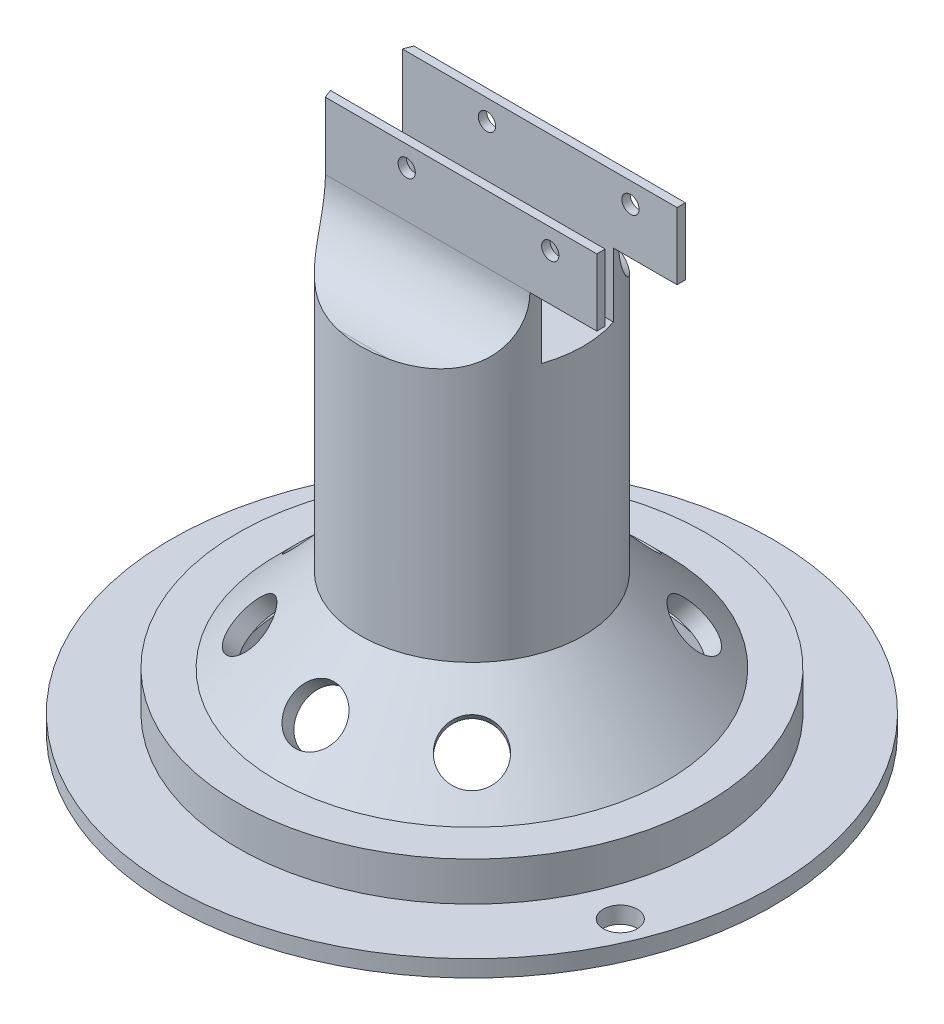
from build123d import *
from build123d.topology import SkipClean

# Parameters (mm, degrees)
R_P_TITION_CIRCULAIRE1_COUNT               = 4
R_P_TITION_CIRCULAIRE1_ANGLE               = 135
R_P_TITION_CIRCULAIRE1_THE_OTHER_WAY_COUNT = 4
R_P_TITION_CIRCULAIRE1_THE_OTHER_WAY_ANGLE = 135
ESQUISSE4_R                                = 20
BOSS_EXTRU_1_DEPTH                         = 45
ENL_V_MAT_EXTRU_1_REACH                    = 88.585
ESQUISSE5_R                                = 5.9
ESQUISSE6_R                                = 16.757359313
ENL_V_MAT_EXTRU_2_DEPTH                    = 45
BOSS_EXTRU_3_DEPTH                         = 23.5
ESQUISSE17_R                               = 1.55
ENL_V_MAT_EXTRU_3_DEPTH                    = 97.805229714
BOSS_EXTRU_4_REACH                         = 98.805
ESQUISSE18_W                               = 12
ESQUISSE18_H                               = 12
ESQUISSE20_W                               = 12
ESQUISSE20_H                               = 12.9
ENL_V_MAT_EXTRU_4_DEPTH                    = 23.5
ENL_V_MAT_EXTRU_5_DEPTH                    = 97.805229714
ENL_V_MAT_EXTRU_5_DEPTH_BACK               = 97.805229714
ESQUISSE21_R                               = 1.55
CONG_1_R                                   = 11.5
REMPLACE_START                             = 4
ESQUISSE22_R                               = 42
ESQUISSE22_R_2                             = 33.757359313
REMPLACE_ENTRETOISE_DEPTH                  = 4
ESQUISSE23_R                               = 54
ESQUISSE23_R_2                             = 33
COMPATIBLE_PURGEUR_DEPTH                   = 3
CONG_2_R                                   = 1
BOSS_EXTRU_7_START                         = -3
ESQUISSE25_R                               = 29.5
ESQUISSE25_R_2                             = 27.5
BOSS_EXTRU_7_DEPTH                         = 3
ENL_V_MAT_EXTRU_7_REACH                    = 122.724
ESQUISSE26_R                               = 3.05


with BuildPart() as part:
    # Esquisse1 → Révolution2 (revolve)
    with BuildSketch(Plane.XY, mode=Mode.PRIVATE) as r_volution2_sk:
        Polygon((-42, -12), (-42, -15), (-33.757359313, -15), (-18.757359313, 0), (0, 0), (0, 3), (-20, 3), (-35, -12), align=None)
    revolve(r_volution2_sk.sketch.rotate(Axis((0, 0, 0), (0, 1, 0)), 270), axis=Axis((0, 0, 0), (0, 1, 0)))

    # Esquisse3 → Enlèvement de matière-Révolution1 (revolve, cut)
    with BuildSketch(Plane.XY, mode=Mode.PRIVATE) as enl_vement_de_mati_re_r_volution1_sk:
        Polygon((-28.915567928, -4.501354365), (-25.4507447, -1.036531137), (-11.487275837, -15), (-14.952099065, -18.464823228), align=None)
    enl_vement_de_mati_re_r_volution1 = revolve(enl_vement_de_mati_re_r_volution1_sk.sketch.rotate(Axis((-28.915567928, -4.501354365, 0), (0.7071067811865492, -0.7071067811865459, 0)), 213.499567999), axis=Axis((-28.915567928, -4.501354365, 0), (0.7071067811865492, -0.7071067811865459, 0)), mode=Mode.SUBTRACT)

    # Répétition circulaire1: Enlèvement de matière-Révolution1 ×4 about axis
    r_p_tition_circulaire1_axis = Axis((0, 3, 0), (0, -1, 0))
    for i in range(1, R_P_TITION_CIRCULAIRE1_COUNT):
        add(enl_vement_de_mati_re_r_volution1.rotate(r_p_tition_circulaire1_axis, i * R_P_TITION_CIRCULAIRE1_ANGLE / (R_P_TITION_CIRCULAIRE1_COUNT - 1)), mode=Mode.SUBTRACT)

    # Répétition circulaire1 the other way: Enlèvement de matière-Révolution1 ×4 about axis
    r_p_tition_circulaire1_the_other_way_axis = Axis((0, 3, 0), (0, 1, 0))
    for i in range(1, R_P_TITION_CIRCULAIRE1_THE_OTHER_WAY_COUNT):
        add(enl_vement_de_mati_re_r_volution1.rotate(r_p_tition_circulaire1_the_other_way_axis, i * R_P_TITION_CIRCULAIRE1_THE_OTHER_WAY_ANGLE / (R_P_TITION_CIRCULAIRE1_THE_OTHER_WAY_COUNT - 1)), mode=Mode.SUBTRACT)

    # Esquisse4 → Boss.-Extru.1 (add)
    with BuildSketch(Plane(origin=(0, 3, 0), x_dir=(1, 0, 0), z_dir=(0, 1, 0))):
        with Locations(Location((0, 0, 0), (0, 0, 90))):
            Circle(ESQUISSE4_R)
    extrude(amount=BOSS_EXTRU_1_DEPTH)

    # Esquisse5 → Enlèv. mat.-Extru.1 (cut, up to next)
    with BuildSketch(Plane(origin=(0, 48, 0), x_dir=(1, 0, 0), z_dir=(0, 1, 0)), mode=Mode.PRIVATE) as enl_v_mat_extru_1_sk1:
        with Locations(Location((0, 0, 0), (0, 0, 270))):
            Circle(ESQUISSE5_R)
    enl_v_mat_extru_1_tool1 = extrude(enl_v_mat_extru_1_sk1.sketch, amount=-ENL_V_MAT_EXTRU_1_REACH, mode=Mode.PRIVATE) & part.part
    add(enl_v_mat_extru_1_tool1.solids().sort_by_distance((0, 48, 0))[0], mode=Mode.SUBTRACT)

    # Esquisse6 → Enlèv. mat.-Extru.2 (cut)
    with BuildSketch(Plane(origin=(0, 0, 0), x_dir=(-1, 0, 0), z_dir=(0, -1, 0))):
        with Locations(Location((0, 0, 0), (0, 0, 90))):
            Circle(ESQUISSE6_R)
    extrude(amount=-ENL_V_MAT_EXTRU_2_DEPTH, mode=Mode.SUBTRACT)

    # Esquisse16 → Boss.-Extru.3 (add)
    with BuildSketch(Plane(origin=(0, 48, 0), x_dir=(1, 0, 0), z_dir=(0, 1, 0))):
        with BuildLine():
            Line((18.352043483, 7.95), (-18.352043483, 7.95))
            ThreePointArc((-18.352043483, 7.95), (-18.65679741, 7.205824754), (-18.931389278, 6.45))
            Line((-18.931389278, 6.45), (18.931389278, 6.45))
            ThreePointArc((18.931389278, 6.45), (18.65679741, 7.205824754), (18.352043483, 7.95))
        make_face()
        with BuildLine():
            Line((18.931389278, -6.45), (-18.931389278, -6.45))
            ThreePointArc((-18.931389278, -6.45), (-18.65679741, -7.205824754), (-18.352043483, -7.95))
            Line((-18.352043483, -7.95), (18.352043483, -7.95))
            ThreePointArc((18.352043483, -7.95), (18.65679741, -7.205824754), (18.931389278, -6.45))
        make_face()
    extrude(amount=BOSS_EXTRU_3_DEPTH)

    # Esquisse17 → Enlèv. mat.-Extru.3 (cut, through all)
    with BuildSketch(Plane.XY.offset(7.95)):
        with Locations((-3.752043483, 67.82)):
            Circle(ESQUISSE17_R)
    extrude(amount=-ENL_V_MAT_EXTRU_3_DEPTH, mode=Mode.SUBTRACT)

    # Boss.-Extru.4: up to this face of the body (flat: up to its plane)
    boss_extru_4_end = Plane(part.part.faces().sort_by_distance((0.033121946, 59.678760392, -7.95))[0])
    # Esquisse18 → Boss.-Extru.4 (add, up to the picked face)
    with BuildSketch(Plane.XY.offset(7.95), mode=Mode.PRIVATE) as boss_extru_4_sk1:
        with Locations((24.352043483, 65.5)):
            Rectangle(ESQUISSE18_W, ESQUISSE18_H)
    boss_extru_4_tool1 = split(extrude(boss_extru_4_sk1.sketch, amount=-BOSS_EXTRU_4_REACH, mode=Mode.PRIVATE), bisect_by=boss_extru_4_end, keep=Keep.BOTH, mode=Mode.PRIVATE)
    add(boss_extru_4_tool1.solids().sort_by(Axis((24.352043, 65.5, 7.95), (0, 0, -1)))[0])

    # Esquisse20 → Enlèv. mat.-Extru.4 (cut)
    with BuildSketch(Plane(origin=(0, 48, 0), x_dir=(1, 0, 0), z_dir=(0, 1, 0))):
        with Locations((24.352043483, 0)):
            Rectangle(ESQUISSE20_W, ESQUISSE20_H)
    extrude(amount=ENL_V_MAT_EXTRU_4_DEPTH, mode=Mode.SUBTRACT)

    # Esquisse21 → Enlèv. mat.-Extru.5 (cut, two sides: drawn at the far end of the back side and taken through both)
    with BuildSketch(Plane.XY.offset(7.95).offset(-ENL_V_MAT_EXTRU_5_DEPTH_BACK)):
        with Locations(Location((21.997956517, 67.82, 0), (0, 0, 180))):
            Circle(ESQUISSE21_R)
    extrude(amount=ENL_V_MAT_EXTRU_5_DEPTH + ENL_V_MAT_EXTRU_5_DEPTH_BACK, mode=Mode.SUBTRACT)

    # Congé1
    # the kernel refuses this fillet: 11.5 mm, written as the material it adds along each edge
    with BuildSketch(Plane(origin=(-47.102043483, 48, 7.95), x_dir=(0, 1, 0), z_dir=(1, 0, 0))) as cong_1_piece_1_section:
        with BuildLine():
            CenterArc((CONG_1_R, CONG_1_R), CONG_1_R, 180, 90)
            Line((0, CONG_1_R), (-CONG_1_R * 0.02, CONG_1_R))
            Line((-CONG_1_R * 0.02, CONG_1_R), (-CONG_1_R * 0.02, -CONG_1_R * 0.02))
            Line((-CONG_1_R * 0.02, -CONG_1_R * 0.02), (CONG_1_R, -CONG_1_R * 0.02))
            Line((CONG_1_R, -CONG_1_R * 0.02), (CONG_1_R, 0))
        make_face()
    cong_1_piece_1 = extrude(amount=94.204086966, mode=Mode.PRIVATE)
    cong_1_piece_1 = cong_1_piece_1 & Plane(origin=(0, 50.762968775, 0), x_dir=(0, 0, -1), z_dir=(0, -1, 0)) * Cylinder(20, 235, mode=Mode.PRIVATE)
    add(cong_1_piece_1)
    with BuildSketch(Plane(origin=(47.102043483, 48, -7.95), x_dir=(0, 0, -1), z_dir=(-1, 0, 0))) as cong_1_piece_2_section:
        with BuildLine():
            CenterArc((CONG_1_R, -CONG_1_R), CONG_1_R, 90, 90)
            Line((0, -CONG_1_R), (-CONG_1_R * 0.02, -CONG_1_R))
            Line((-CONG_1_R * 0.02, -CONG_1_R), (-CONG_1_R * 0.02, CONG_1_R * 0.02))
            Line((-CONG_1_R * 0.02, CONG_1_R * 0.02), (CONG_1_R, CONG_1_R * 0.02))
            Line((CONG_1_R, CONG_1_R * 0.02), (CONG_1_R, 0))
        make_face()
    cong_1_piece_2 = extrude(amount=94.204086966, mode=Mode.PRIVATE)
    cong_1_piece_2 = cong_1_piece_2 & Plane(origin=(0, 50.762971325, 0), x_dir=(0, 0, -1), z_dir=(0, -1, 0)) * Cylinder(20, 235, mode=Mode.PRIVATE)
    add(cong_1_piece_2)

    # Esquisse22 → remplace entretoise (add)
    with SkipClean():  # the faces are left unmerged after this step: merging them gives an invalid solid
        with BuildSketch(Plane(origin=(0, -15, 0), x_dir=(-1, 0, 0), z_dir=(0, -1, 0)).offset(REMPLACE_START)):
            with Locations(Location((0, 0, 0), (0, 0, 90))):
                Circle(ESQUISSE22_R)
            with Locations(Location((0, 0, 0), (0, 0, 90))):
                Circle(ESQUISSE22_R_2, mode=Mode.SUBTRACT)
        extrude(amount=-REMPLACE_ENTRETOISE_DEPTH)

    # Esquisse23 → compatible purgeur (add)
    with SkipClean():  # the faces are left unmerged after this step: merging them gives an invalid solid
        with BuildSketch(Plane.XZ.offset(19)):
            with Locations(Location((0, 0, 0), (0, 0, 270))):
                Circle(ESQUISSE23_R)
            with Locations(Location((0, 0, 0), (0, 0, 270))):
                Circle(ESQUISSE23_R_2, mode=Mode.SUBTRACT)
        extrude(amount=COMPATIBLE_PURGEUR_DEPTH)

    # Congé2
    # the kernel refuses this fillet: 1 mm, written as the material it adds along each edge
    with BuildSketch(Plane(origin=(0, -19, 0), x_dir=(0, 0, -1), z_dir=(-1, 0, 0))) as cong_2_piece_1:
        with BuildLine():
            CenterArc((32.757359313, -0.970116229), CONG_2_R, 0, 75.957551572)
            Line((33.757359313, -0.970116229), (33.777359313, -0.970116229))
            Line((33.777359313, -0.970116229), (33.777359313, 0))
            Line((33.777359313, 0), (33.757359313, 0.02))
            ThreePointArc((33.757359313, 0.02), (33.378679656, 0.02), (33.004852814, 0.019402325))
            Line((33.004852814, 0.019402325), (33, 0))
        make_face()
    revolve(axis=Axis((0, -19, 0), (0, -1, 0)))

    # Esquisse25 → Boss.-Extru.7 (add)
    # profile 1 of 4: a face of its own
    with SkipClean():  # the faces are left unmerged after this step: merging them gives an invalid solid
        with BuildSketch(Plane(origin=(0, -22, 0), x_dir=(-1, 0, 0), z_dir=(0, -1, 0)).offset(BOSS_EXTRU_7_START)):
            with BuildLine():
                ThreePointArc((-29.393876913, -2.5), (-29.5, 0), (-29.393876913, 2.5))
                Line((-29.393876913, 2.5), (-32.905166768, 2.5))
                ThreePointArc((-32.905166768, 2.5), (-33, 0), (-32.905166768, -2.5))
                Line((-32.905166768, -2.5), (-29.393876913, -2.5))
            make_face()
        # profile 2 of 4: a face of its own
        with BuildSketch(Plane(origin=(0, -22, 0), x_dir=(-1, 0, 0), z_dir=(0, -1, 0)).offset(BOSS_EXTRU_7_START)):
            with BuildLine():
                ThreePointArc((12.531874947, 26.705844123), (14.75, 25.547749412), (16.862001966, 24.205844123))
                Line((16.862001966, 24.205844123), (18.617646893, 27.246710336))
                ThreePointArc((18.617646893, 27.246710336), (16.5, 28.578838325), (14.287519874, 29.746710336))
                Line((14.287519874, 29.746710336), (12.531874947, 26.705844123))
            make_face()
        # profile 3 of 4: a face of its own
        with BuildSketch(Plane(origin=(0, -22, 0), x_dir=(-1, 0, 0), z_dir=(0, -1, 0)).offset(BOSS_EXTRU_7_START)):
            with BuildLine():
                Line((18.617646893, -27.246710336), (16.862001966, -24.205844123))
                ThreePointArc((16.862001966, -24.205844123), (14.75, -25.547749412), (12.531874947, -26.705844123))
                Line((12.531874947, -26.705844123), (14.287519874, -29.746710336))
                ThreePointArc((14.287519874, -29.746710336), (16.5, -28.578838325), (18.617646893, -27.246710336))
            make_face()
        # profile 4 of 4: a face of its own
        with BuildSketch(Plane(origin=(0, -22, 0), x_dir=(-1, 0, 0), z_dir=(0, -1, 0)).offset(BOSS_EXTRU_7_START)):
            Circle(ESQUISSE25_R)
            with Locations(Location((0, 0, 0), (0, 0, 90))):
                Circle(ESQUISSE25_R_2, mode=Mode.SUBTRACT)
        extrude(amount=BOSS_EXTRU_7_DEPTH)

    # Esquisse26 → Enlèv. mat.-Extru.7 (cut, up to next)
    with BuildSketch(Plane.XZ.offset(22), mode=Mode.PRIVATE) as enl_v_mat_extru_7_sk1:
        with Locations(Location((45.299126625, 18.681250681, 0), (0, 0, 270))):
            Circle(ESQUISSE26_R)
    enl_v_mat_extru_7_tool1 = extrude(enl_v_mat_extru_7_sk1.sketch, amount=-ENL_V_MAT_EXTRU_7_REACH, mode=Mode.PRIVATE) & part.part
    add(enl_v_mat_extru_7_tool1.solids().sort_by_distance((45.299127, -22, 18.681251))[0], mode=Mode.SUBTRACT)


solid = part.part
